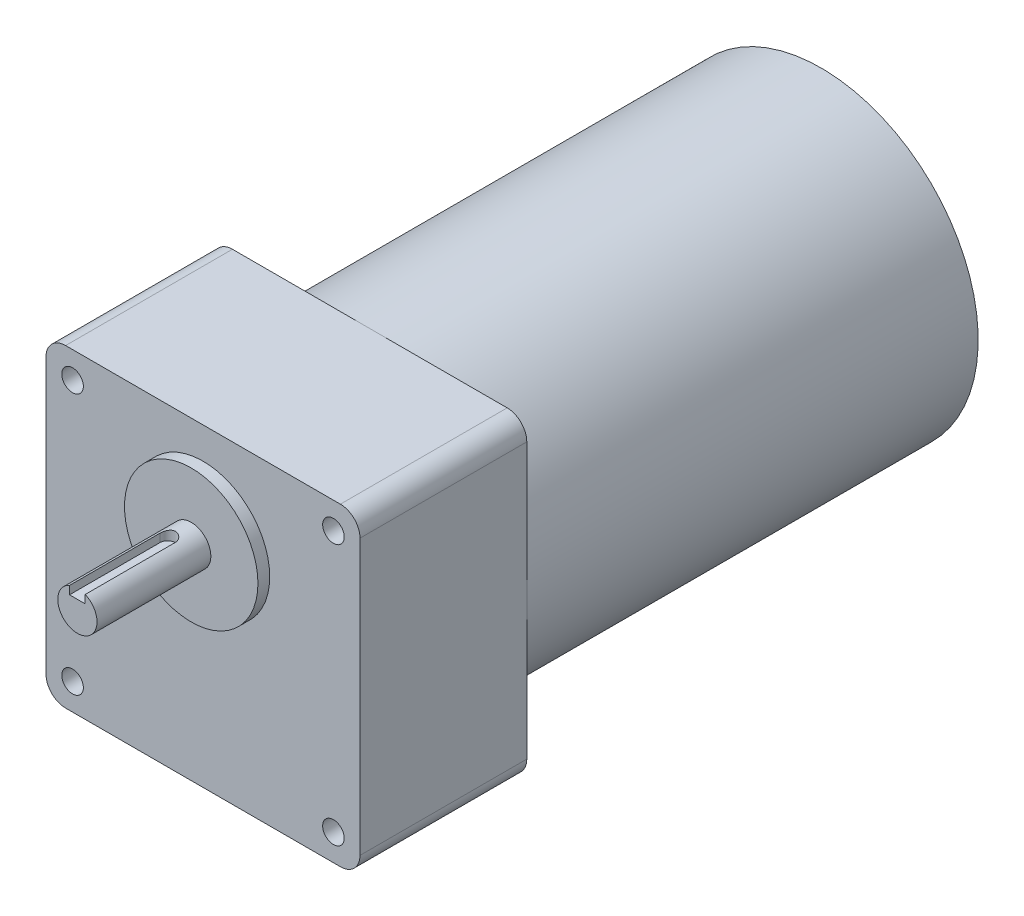
from build123d import *

# Parameters (mm, degrees)
SKETCH_1_W          = 80
SKETCH_1_H          = 80
EXTRUDE_1_DEPTH     = 10
SKETCH_2_R          = 17
EXTRUDE_2_DEPTH     = 3
SKETCH_3_R          = 5
EXTRUDE_3_DEPTH     = 29
CUT_EXTRUDE_1_DEPTH = 23
CUT_EXTRUDE_4_DEPTH = 2.5
SKETCH_7_W          = 80
SKETCH_7_H          = 80
EXTRUDE_6_DEPTH     = 32.5
SKETCH_10_R         = 40
EXTRUDE_7_DEPTH     = 115
SKETCH_11_R         = 14
EXTRUDE_8_DEPTH     = 5
SKETCH_12_R         = 2.75
CUT_EXTRUDE_5_DEPTH = 173.064668076
FILLET_1_R          = 5


with BuildPart() as part:
    # 스케치1 → 보스-돌출1 (new body)
    with BuildSketch(Plane.XY):
        Rectangle(SKETCH_1_W, SKETCH_1_H)
    extrude(amount=EXTRUDE_1_DEPTH)

    # 스케치2 → 보스-돌출2 (add)
    with BuildSketch(Plane.XY.offset(10)):
        with Locations((0, 15)):
            Circle(SKETCH_2_R)
    extrude(amount=EXTRUDE_2_DEPTH)

    # 스케치3 → 보스-돌출3 (add)
    with BuildSketch(Plane.XY.offset(13)):
        with Locations((0, 15)):
            Circle(SKETCH_3_R)
    extrude(amount=EXTRUDE_3_DEPTH)

    # 스케치4 → 컷-돌출1 (cut)
    with BuildSketch(Plane.XY.offset(42)):
        Polygon((0, 17.5), (-2, 17.5), (-2, 20.912683476), (2, 20.912683476), (2, 17.5), align=None)
    extrude(amount=-CUT_EXTRUDE_1_DEPTH, mode=Mode.SUBTRACT)

    # 스케치6 → 컷-돌출4 (cut)
    with BuildSketch(Plane(origin=(0, 20, 0), x_dir=(1, 0, 0), z_dir=(0, 1, 0))):
        with BuildLine():
            Line((-2, -19), (-2, -52.407669752))
            Line((-2, -52.407669752), (2, -52.407669752))
            Line((2, -52.407669752), (2, -19))
            ThreePointArc((2, -19), (0, -17), (-2, -19))
        make_face()
    extrude(amount=-CUT_EXTRUDE_4_DEPTH, mode=Mode.SUBTRACT)

    # 스케치7 → 보스-돌출6 (add)
    with BuildSketch(Plane(origin=(0, 0, 0), x_dir=(-1, 0, 0), z_dir=(0, 0, -1))):
        Rectangle(SKETCH_7_W, SKETCH_7_H)
    extrude(amount=EXTRUDE_6_DEPTH)

    # 스케치10 → 보스-돌출7 (add)
    with BuildSketch(Plane(origin=(0, 0, -32.5), x_dir=(-1, 0, 0), z_dir=(0, 0, -1))):
        Circle(SKETCH_10_R)
    extrude(amount=EXTRUDE_7_DEPTH)

    # 스케치11 → 보스-돌출8 (add)
    with BuildSketch(Plane(origin=(0, 0, -147.5), x_dir=(-1, 0, 0), z_dir=(0, 0, -1))):
        Circle(SKETCH_11_R)
    extrude(amount=EXTRUDE_8_DEPTH)

    # 스케치12 → 컷-돌출5 (cut, through all)
    with BuildSketch(Plane.XY.offset(10)):
        with Locations((33.234018716, 33.234018716)):
            Circle(SKETCH_12_R)
        with Locations((-33.234018716, 33.234018716)):
            Circle(SKETCH_12_R)
        with Locations((-33.234018716, -33.234018716)):
            Circle(SKETCH_12_R)
        with Locations((33.234018716, -33.234018716)):
            Circle(SKETCH_12_R)
    extrude(amount=-CUT_EXTRUDE_5_DEPTH, mode=Mode.SUBTRACT)

    # 필렛1
    fillet_1_edges = [part.edges().sort_by_distance(p)[0] for p in [
        (-40, 40, -11.25),
        (-40, -40, -11.25),
        (40, -40, -11.25),
        (40, 40, -11.25),
    ]]
    fillet(fillet_1_edges, radius=FILLET_1_R)


solid = part.part
